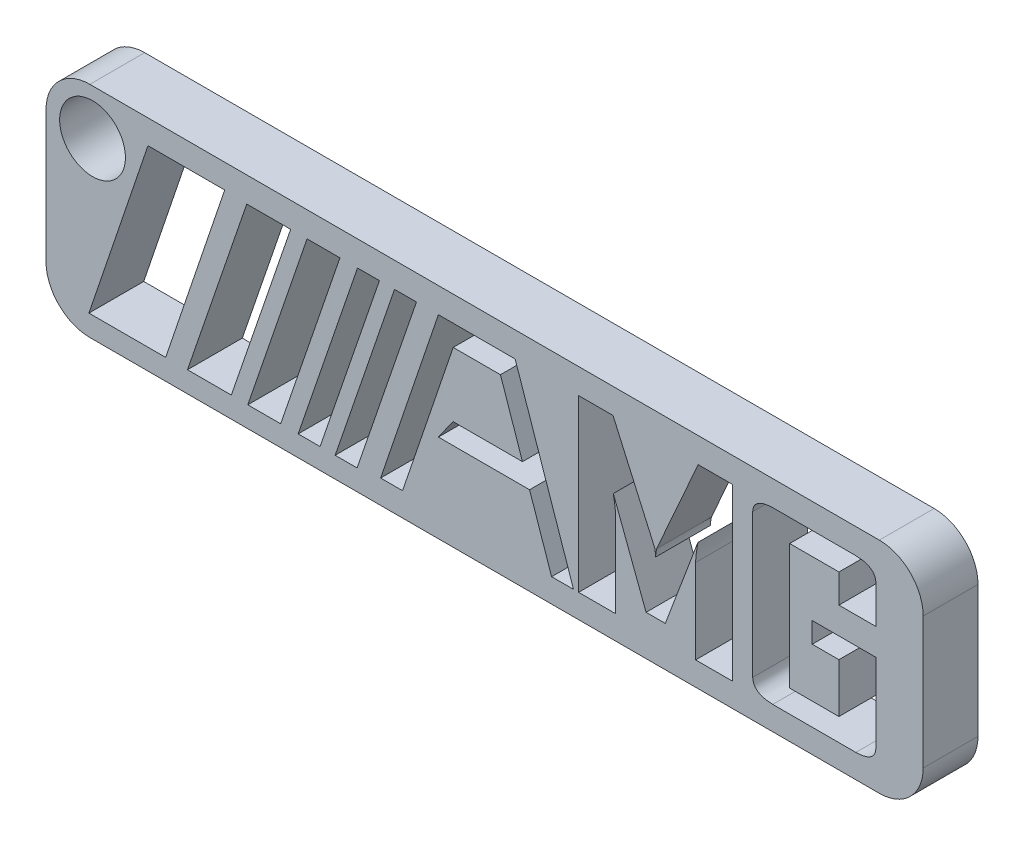
from build123d import *

# Parameters (mm, degrees)
ESQUISSE1_W                  = 80
ESQUISSE1_H                  = 20
BOSS_EXTRU_1_DEPTH           = 5
CONG_1_R                     = 4
ENL_V_MAT_EXTRU_1_DEPTH      = 83.613558209
ENL_V_START                  = -5
ENL_V_MAT_EXTRU_2_DEPTH      = 5
ESQUISSE11_W                 = 13.611032385
ESQUISSE11_H                 = 17.64061434
BOSS_EXTRU_8_DEPTH           = 5
ENL_V_MAT_EXTRU_3_DEPTH      = 83.613558336
ENL_V_MAT_EXTRU_3_DEPTH_BACK = 83.613558336
ESQUISSE13_R                 = 3
ENL_V_MAT_EXTRU_4_DEPTH      = 33


# Read off the part's stored shape, not the designer's step: Enlèv. mat.-Extru.2
with BuildPart() as part:
    # Esquisse1 → Boss.-Extru.1 (new body)
    with BuildSketch(Plane.XY):
        with Locations((40, -10)):
            Rectangle(ESQUISSE1_W, ESQUISSE1_H)
    extrude(amount=BOSS_EXTRU_1_DEPTH)

    # Congé1
    cong_1_edges = [part.edges().sort_by_distance(p)[0] for p in [
        (0, 0, 2.5),
        (80, 0, 2.5),
        (80, -20, 2.5),
        (0, -20, 2.5),
    ]]
    fillet(cong_1_edges, radius=CONG_1_R)

    # Esquisse2 → Enlèv. mat.-Extru.1 (cut, through all)
    with BuildSketch(Plane.XY.offset(5)):
        Polygon((28.410040172, -2.300084773), (30.410040172, -2.300084773), (24.995829866, -18.113699025), (22.995829866, -18.113699025), align=None)
        Polygon((9.298142424, -2.198086037), (16.298142424, -2.198086037), (10.914062948, -18.113699025), (3.914062948, -18.113699025), align=None)
        Polygon((18.309829725, -2.300084773), (22.309829725, -2.300084773), (16.902589817, -18.093340154), (12.902589817, -18.093340154), align=None)
        Polygon((23.808061727, -2.300084773), (26.808061727, -2.300084773), (21.404325417, -18.111661936), (18.404325417, -18.111661936), align=None)
        Polygon((31.786127586, -2.300084773), (33.786127586, -2.300084773), (28.371917279, -18.113699025), (26.371917279, -18.113699025), align=None)
    extrude(amount=-ENL_V_MAT_EXTRU_1_DEPTH, mode=Mode.SUBTRACT)

    # Enlèv. mat.-Extru.2 outline → Enlèv. mat.-Extru.2 (cut)
    # profile 1 of 3: a face of its own
    with BuildSketch(Plane.XY.offset(5).offset(ENL_V_START)):
        with BuildLine():
            add(Edge.make_bspline(
                [(75.686567024, -16.611023442), (75.678643784, -16.704663886), (75.663447013, -16.884266233), (75.563839443, -17.132408637), (75.415616385, -17.347383223), (75.204262037, -17.518269705), (74.945020643, -17.657920052), (74.629763147, -17.753299102), (74.263391467, -17.817731699), (74.000846179, -17.830167685), (73.861085096, -17.83678775)],
                knots=[0, 0, 0, 0, 0.114098337, 0.218840581, 0.322174175, 0.429434412, 0.547100708, 0.679564678, 0.829422238, 1, 1, 1, 1], degree=3))
            Line((75.686567024, -16.611023442), (75.686567024, -9.411486545))
            Line((75.686567024, -9.411486545), (69.882470639, -9.411486545))
            Line((69.882470639, -9.411486545), (69.882470639, -11.283775701))
            Line((69.882470639, -11.283775701), (72.316446542, -11.283775701))
            Line((72.316446542, -11.283775701), (72.316446542, -15.777269677))
            Line((72.316446542, -15.777269677), (67.822952566, -15.777269677))
            Line((67.822952566, -15.777269677), (67.822952566, -4.356305822))
            Line((67.822952566, -4.356305822), (72.316446542, -4.356305822))
            Line((72.316446542, -4.356305822), (72.316446542, -6.977510641))
            Line((72.316446542, -6.977510641), (75.686567024, -6.977510641))
            Line((75.686567024, -6.977510641), (75.686567024, -3.522552057))
            add(Edge.make_bspline(
                [(73.861085096, -2.29678775), (74.000846179, -2.303407815), (74.263391467, -2.3158438), (74.629763147, -2.380276397), (74.945020643, -2.475655447), (75.204262037, -2.615305794), (75.415616385, -2.786192276), (75.563839443, -3.001166862), (75.663447013, -3.249309266), (75.678643784, -3.428911613), (75.686567024, -3.522552057)],
                knots=[0, 0, 0, 0, 0.170577762, 0.320435322, 0.452899292, 0.570565588, 0.677825825, 0.781159419, 0.885901663, 1, 1, 1, 1], degree=3))
            Line((73.861085096, -2.29678775), (66.322195789, -2.29678775))
            add(Edge.make_bspline(
                [(64.452832084, -3.522552057), (64.460490101, -3.428813179), (64.475207603, -3.248661832), (64.578900626, -3.001012416), (64.72992953, -2.785012839), (64.947387079, -2.615412784), (65.212124175, -2.475706721), (65.534969931, -2.379572165), (65.910264022, -2.316247539), (66.179534857, -2.303527098), (66.322195789, -2.29678775)],
                knots=[0, 0, 0, 0, 0.112348161, 0.215915455, 0.318343111, 0.425762474, 0.543690884, 0.676356302, 0.828532073, 1, 1, 1, 1], degree=3))
            Line((64.452832084, -3.522552057), (64.452832084, -16.611023442))
            add(Edge.make_bspline(
                [(66.278314012, -17.83678775), (66.138552929, -17.830167685), (65.876007642, -17.817731699), (65.509635961, -17.753299102), (65.194378466, -17.657920052), (64.935137072, -17.518269705), (64.723782723, -17.347383223), (64.575559665, -17.132408637), (64.475952096, -16.884266233), (64.460755324, -16.704663886), (64.452832084, -16.611023442)],
                knots=[0, 0, 0, 0, 0.170577762, 0.320435322, 0.452899292, 0.570565588, 0.677825825, 0.781159419, 0.885901663, 1, 1, 1, 1], degree=3))
            Line((66.278314012, -17.83678775), (73.861085096, -17.83678775))
        make_face()
    # profile 2 of 3: a face of its own
    with BuildSketch(Plane.XY.offset(5).offset(ENL_V_START)):
        with BuildLine():
            add(Edge.make_bspline(
                [(59.247868229, -10.142849497), (59.250113416, -10.031576234), (59.255029992, -9.787906808), (59.301768342, -9.394005261), (59.364432817, -8.9400039), (59.423938248, -8.619443962), (59.455575307, -8.4490129)],
                knots=[0, 0, 0, 0, 0.195301478, 0.427676852, 0.695714808, 1, 1, 1, 1], degree=3))
            Line((59.247868229, -10.142849497), (59.247868229, -17.83678775))
            Line((59.247868229, -17.83678775), (62.617988711, -17.83678775))
            Line((62.617988711, -17.83678775), (62.617988711, -2.29678775))
            Line((62.617988711, -2.29678775), (59.481904374, -2.29678775))
            Line((59.481904374, -2.29678775), (55.68759338, -10.836181575))
            add(Edge.make_bspline(
                [(55.596904374, -11.538290009), (55.59815665, -11.492405908), (55.600881716, -11.392557927), (55.62162629, -11.229918497), (55.645376833, -11.040932864), (55.672949182, -10.907206292), (55.68759338, -10.836181575)],
                knots=[0, 0, 0, 0, 0.19413449, 0.422454333, 0.693254547, 1, 1, 1, 1], degree=3))
            add(Edge.make_bspline(
                [(55.506215368, -10.836181575), (55.516865461, -10.868148772), (55.54346006, -10.947974815), (55.561126156, -11.099283482), (55.582536457, -11.300899182), (55.59176432, -11.45336457), (55.596904374, -11.538290009)],
                knots=[0, 0, 0, 0, 0.142095852, 0.354830918, 0.640631437, 1, 1, 1, 1], degree=3))
            Line((55.506215368, -10.836181575), (51.711904374, -2.29678775))
            Line((51.711904374, -2.29678775), (48.575820036, -2.29678775))
            Line((48.575820036, -2.29678775), (48.575820036, -17.83678775))
            Line((48.575820036, -17.83678775), (51.945940518, -17.83678775))
            Line((51.945940518, -17.83678775), (51.945940518, -10.142849497))
            add(Edge.make_bspline(
                [(51.741158892, -8.4490129), (51.77262663, -8.62239324), (51.831532725, -8.946952903), (51.895555168, -9.402629403), (51.938009232, -9.793916754), (51.94345609, -10.033548389), (51.945940518, -10.142849497)],
                knots=[0, 0, 0, 0, 0.309420385, 0.579220093, 0.808073296, 1, 1, 1, 1], degree=3))
            Line((51.741158892, -8.4490129), (54.728045187, -16.338956424))
            Line((54.728045187, -16.338956424), (56.480390819, -16.338956424))
            Line((56.480390819, -16.338956424), (59.455575307, -8.4490129))
        make_face()
    # profile 3 of 3: a face of its own
    with BuildSketch(Plane.XY.offset(5).offset(ENL_V_START)):
        Polygon((44.119771843, -17.83678775), (47.489892325, -17.83678775), (43.019801964, -2.29678775), (39.439048952, -2.29678775), (34.945554976, -17.795831424), (34.945554976, -17.83678775), (38.315675458, -17.83678775), (39.023634795, -15.028354015), (43.41766341, -15.028354015), align=None)
        Polygon((41.217723651, -5.921422539), (42.923262054, -12.968835942), (39.488781633, -12.968835942), align=None, mode=Mode.SUBTRACT)
    extrude(amount=ENL_V_MAT_EXTRU_2_DEPTH, mode=Mode.SUBTRACT)

    # Esquisse11 → Boss.-Extru.8 (add)
    with BuildSketch(Plane.XY.offset(5)):
        with Locations((41.097921838, -10.121676789)):
            Rectangle(ESQUISSE11_W, ESQUISSE11_H)
    extrude(amount=-BOSS_EXTRU_8_DEPTH)

    # Esquisse12 → Enlèv. mat.-Extru.3 (cut, two sides: drawn at the far end of the back side and taken through both)
    with BuildSketch(Plane.XY.offset(5).offset(-ENL_V_MAT_EXTRU_3_DEPTH_BACK)):
        Polygon((35.786127586, -2.300084773), (42.786127586, -2.300084773), (48.111179633, -17.834694794), (46.111179633, -17.834694794), (44.102998893, -11.969278829), (35.786127586, -11.969278829), (37.115967439, -10.077108111), (43.455164056, -10.077108111), (41.446983316, -4.211692145), (37.138004335, -4.211692145), (32.518467193, -17.83678775), (30.518467193, -17.83678775), align=None)
    extrude(amount=ENL_V_MAT_EXTRU_3_DEPTH + ENL_V_MAT_EXTRU_3_DEPTH_BACK, mode=Mode.SUBTRACT)

    # Esquisse13 → Enlèv. mat.-Extru.4 (cut)
    with BuildSketch(Plane.XY.offset(5)):
        with Locations((4.24401363, -4.167068495)):
            Circle(ESQUISSE13_R)
    extrude(amount=-ENL_V_MAT_EXTRU_4_DEPTH, mode=Mode.SUBTRACT)


solid = part.part
